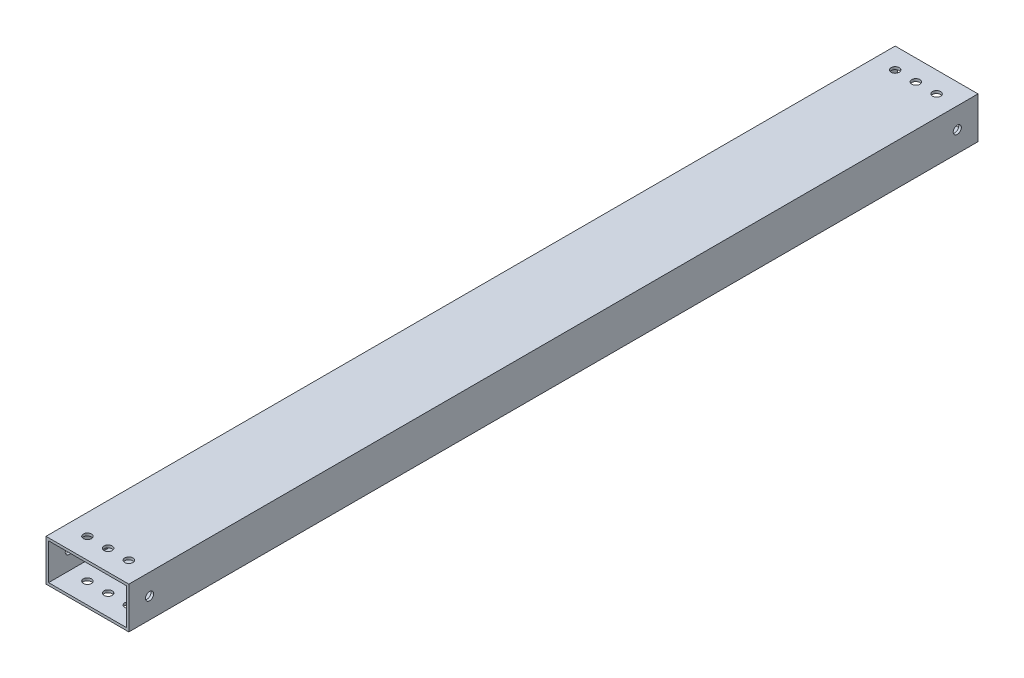
from build123d import *

# Parameters (mm, degrees)
SKETCH1_W           = 50.8
SKETCH1_H           = 25.4
SKETCH1_W_2         = 47.625
SKETCH1_H_2         = 22.225
BOSS_EXTRUDE1_DEPTH = 260.35
SKETCH2_R           = 2.4892
CUT_EXTRUDE1_DEPTH  = 263.8163665
SKETCH3_R           = 2.4892
CUT_EXTRUDE2_DEPTH  = 266.563650562


with BuildPart() as part:
    # Sketch1 → Boss-Extrude1 (new, symmetric)
    with BuildSketch(Plane.XY):
        Rectangle(SKETCH1_W, SKETCH1_H)
        Rectangle(SKETCH1_W_2, SKETCH1_H_2, mode=Mode.SUBTRACT)
    extrude(amount=BOSS_EXTRUDE1_DEPTH, both=True)

    # Sketch2 → Cut-Extrude1 (cut, through all)
    with BuildSketch(Plane(origin=(0, 12.7, 0), x_dir=(1, 0, 0), z_dir=(0, 1, 0))):
        with Locations((-12.7, 247.65)):
            Circle(SKETCH2_R)
        with Locations((0, 247.65)):
            Circle(SKETCH2_R)
        with Locations((12.7, 247.65)):
            Circle(SKETCH2_R)
        with Locations((12.7, -247.65)):
            Circle(SKETCH2_R)
        with Locations((0, -247.65)):
            Circle(SKETCH2_R)
        with Locations((-12.7, -247.65)):
            Circle(SKETCH2_R)
    extrude(amount=-CUT_EXTRUDE1_DEPTH, mode=Mode.SUBTRACT)

    # Sketch3 → Cut-Extrude2 (cut, through all)
    with BuildSketch(Plane(origin=(25.4, 0, 0), x_dir=(0, 0, -1), z_dir=(1, 0, 0))):
        with Locations((247.65, 0)):
            Circle(SKETCH3_R)
        with Locations((-247.65, 0)):
            Circle(SKETCH3_R)
    extrude(amount=-CUT_EXTRUDE2_DEPTH, mode=Mode.SUBTRACT)


solid = part.part
